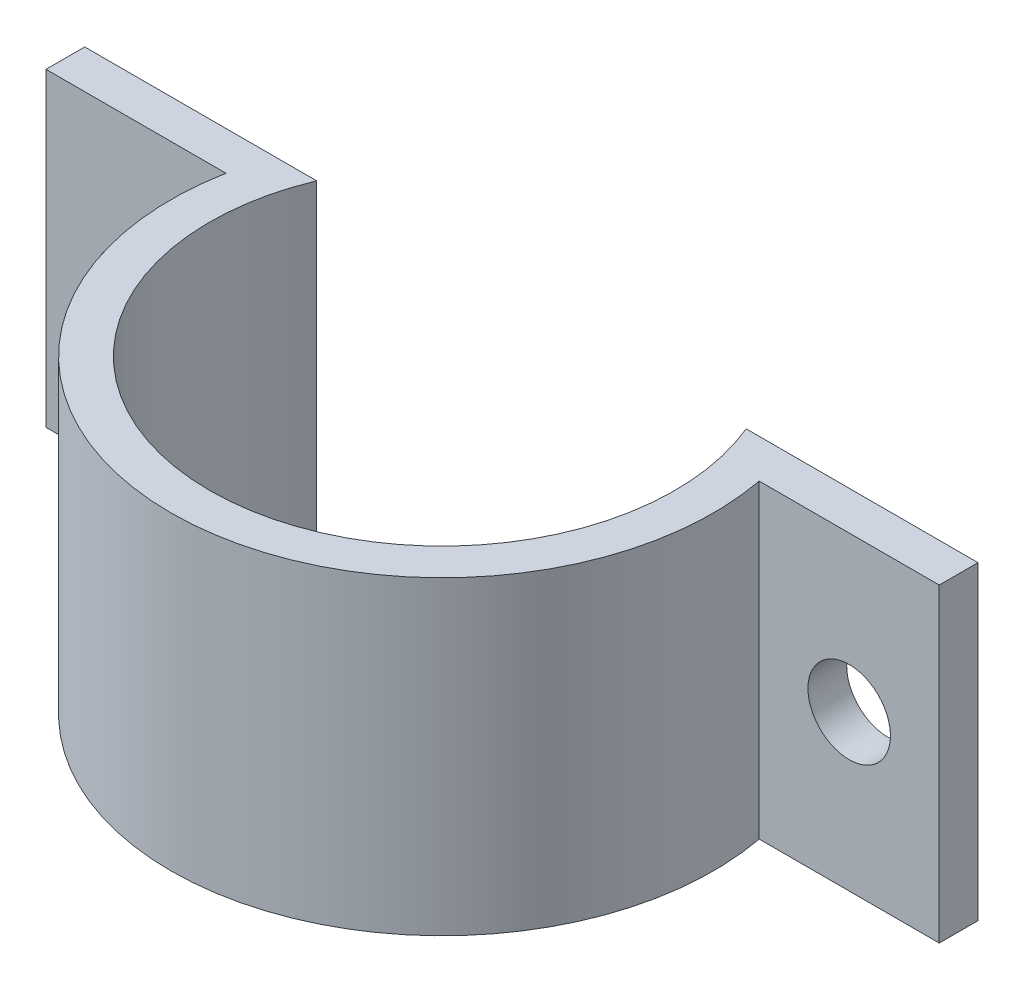
from build123d import *

# Parameters (mm, degrees)
SKETCH1_R           = 19.05
BOSS_EXTRUDE1_DEPTH = 25.4
SKETCH2_R           = 3.3782
CUT_EXTRUDE1_DEPTH  = 58.192584653
SKETCH3_W           = 84.126846883
SKETCH3_H           = 24.140829336
CUT_EXTRUDE2_DEPTH  = 50.776976184


with BuildPart() as part:
    # Sketch1 → Boss-Extrude1 (new body)
    with BuildSketch(Plane(origin=(0, 0, 0), x_dir=(1, 0, 0), z_dir=(0, 1, 0))):
        with BuildLine():
            Line((36.587384889, 13.6525), (17.537384889, 13.6525))
            ThreePointArc((17.537384889, 13.6525), (0, 22.225), (-17.537384889, 13.6525))
            Line((-17.537384889, 13.6525), (-36.587384889, 13.6525))
            Line((-36.587384889, 13.6525), (-36.587384889, 4.1275))
            Line((-36.587384889, 4.1275), (-21.838369187, 4.1275))
            ThreePointArc((-21.838369187, 4.1275), (0, -22.225), (21.838369187, 4.1275))
            Line((21.838369187, 4.1275), (36.587384889, 4.1275))
            Line((36.587384889, 4.1275), (36.587384889, 13.6525))
        make_face()
        Circle(SKETCH1_R, mode=Mode.SUBTRACT)
    extrude(amount=BOSS_EXTRUDE1_DEPTH)

    # Sketch2 → Cut-Extrude1 (cut, through all)
    with BuildSketch(Plane(origin=(0, 0, -13.6525), x_dir=(-1, 0, 0), z_dir=(0, 0, -1))):
        with Locations((29.21, 12.7)):
            Circle(SKETCH2_R)
        with Locations((-29.21, 12.7)):
            Circle(SKETCH2_R)
    extrude(amount=-CUT_EXTRUDE1_DEPTH, mode=Mode.SUBTRACT)

    # Sketch3 → Cut-Extrude2 (cut, through all)
    with BuildSketch(Plane(origin=(0, 25.4, 0), x_dir=(1, 0, 0), z_dir=(0, 1, 0))):
        with Locations((0.41143502, 19.372914668)):
            Rectangle(SKETCH3_W, SKETCH3_H)
    extrude(amount=-CUT_EXTRUDE2_DEPTH, mode=Mode.SUBTRACT)


solid = part.part
